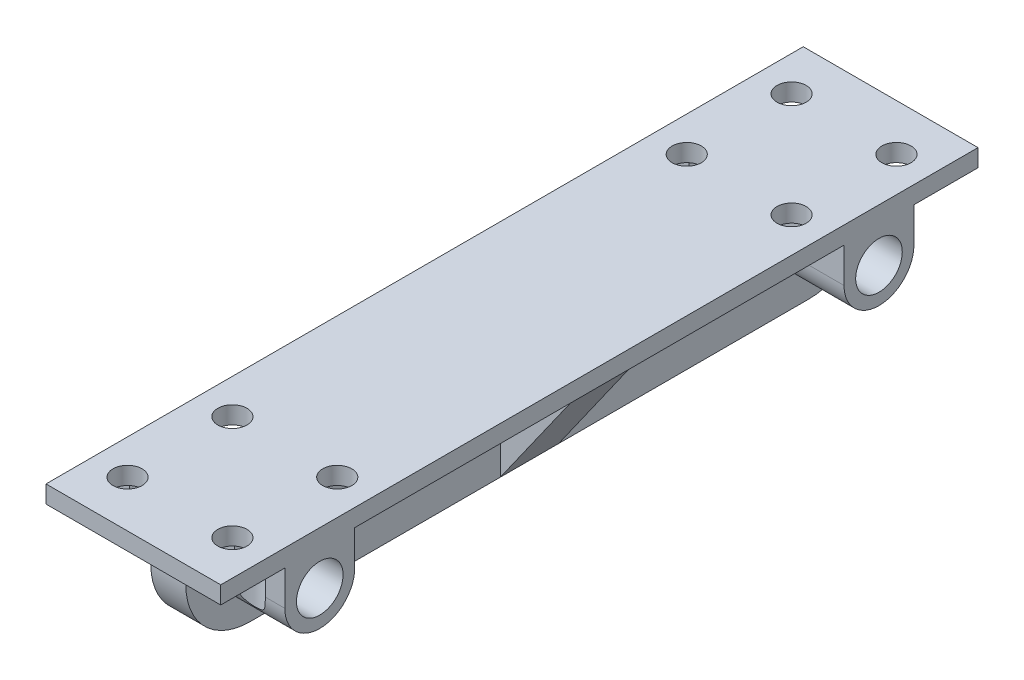
from build123d import *
from OCP.BRepFilletAPI import BRepFilletAPI_MakeChamfer

# Parameters (mm, degrees)
SKETCH1_W           = 30
SKETCH1_H           = 130
SKETCH1_R           = 2.5
BOSS_EXTRUDE1_DEPTH = 3
SKETCH2_W           = 30
SKETCH2_H           = 12
BOSS_EXTRUDE2_DEPTH = 12
CUT_EXTRUDE1_REACH  = 88.274
SKETCH3_R           = 4
FILLET1_R           = 6
SKETCH4_R           = 4
CUT_EXTRUDE2_DEPTH  = 19
SKETCH5_W           = 6
SKETCH5_H           = 84
SKETCH5_H_2         = 11
BOSS_EXTRUDE3_DEPTH = 6
CHAMFER1_SIZE       = 6
BOSS_EXTRUDE4_DEPTH = 6
SKETCH7_W           = 12
SKETCH7_H           = 10
BOSS_EXTRUDE5_DEPTH = 17
CHAMFER2_SIZE       = 17
CHAMFER2_SIZE2      = 12


with BuildPart() as part:
    # Sketch1 → Boss-Extrude1 (new body)
    with BuildSketch(Plane(origin=(0, 0, 0), x_dir=(1, 0, 0), z_dir=(0, 1, 0))):
        with Locations((-7.37923135, 14.994995261)):
            Rectangle(SKETCH1_W, SKETCH1_H)
        with Locations(Location((-16.37923135, -24.005004739, 0), (0, 0, 270))):
            Circle(SKETCH1_R, mode=Mode.SUBTRACT)
        with Locations(Location((1.62076865, -24.005004739, 0), (0, 0, 270))):
            Circle(SKETCH1_R, mode=Mode.SUBTRACT)
        with Locations(Location((1.62076865, -42.005004739, 0), (0, 0, 270))):
            Circle(SKETCH1_R, mode=Mode.SUBTRACT)
        with Locations(Location((-16.37923135, -42.005004739, 0), (0, 0, 270))):
            Circle(SKETCH1_R, mode=Mode.SUBTRACT)
        with Locations(Location((-16.37923135, 71.994995261, 0), (0, 0, 270))):
            Circle(SKETCH1_R, mode=Mode.SUBTRACT)
        with Locations(Location((-16.37923135, 53.994995261, 0), (0, 0, 270))):
            Circle(SKETCH1_R, mode=Mode.SUBTRACT)
        with Locations(Location((1.62076865, 71.994995261, 0), (0, 0, 270))):
            Circle(SKETCH1_R, mode=Mode.SUBTRACT)
        with Locations(Location((1.62076865, 53.994995261, 0), (0, 0, 270))):
            Circle(SKETCH1_R, mode=Mode.SUBTRACT)
    extrude(amount=BOSS_EXTRUDE1_DEPTH)

    # Sketch2 → Boss-Extrude2 (add)
    with BuildSketch(Plane.XZ):
        with Locations((-7.37923135, -62.994995261)):
            Rectangle(SKETCH2_W, SKETCH2_H)
        with Locations((-7.37923135, 33.005004739)):
            Rectangle(SKETCH2_W, SKETCH2_H)
    extrude(amount=BOSS_EXTRUDE2_DEPTH)

    # Sketch3 → Cut-Extrude1 (cut, up to next)
    with BuildSketch(Plane(origin=(7.62076865, 0, 0), x_dir=(0, 0, -1), z_dir=(1, 0, 0)), mode=Mode.PRIVATE) as cut_extrude1_sk1:
        with Locations((-33.005004739, -6)):
            Circle(SKETCH3_R)
    cut_extrude1_tool1 = extrude(cut_extrude1_sk1.sketch, amount=-CUT_EXTRUDE1_REACH, mode=Mode.PRIVATE) & part.part
    # Sketch3 → Cut-Extrude1 (cut, up to next)
    with BuildSketch(Plane(origin=(7.62076865, 0, 0), x_dir=(0, 0, -1), z_dir=(1, 0, 0)), mode=Mode.PRIVATE) as cut_extrude1_sk2:
        with Locations((62.994995261, -6)):
            Circle(SKETCH3_R)
    cut_extrude1_tool2 = extrude(cut_extrude1_sk2.sketch, amount=-CUT_EXTRUDE1_REACH, mode=Mode.PRIVATE) & part.part
    add(cut_extrude1_tool1.solids().sort_by_distance((7.620769, -6, 33.005005))[0], mode=Mode.SUBTRACT)
    add(cut_extrude1_tool2.solids().sort_by_distance((7.620769, -6, -62.994995))[0], mode=Mode.SUBTRACT)

    # Fillet1
    fillet1_edges = [part.edges().sort_by_distance(p)[0] for p in [
        (-7.37923135, -12, -68.994995261),
        (-7.37923135, -12, -56.994995261),
        (-7.37923135, -12, 27.005004739),
        (-7.37923135, -12, 39.005004739),
    ]]
    fillet(fillet1_edges, radius=FILLET1_R - 0.0001)  # a hair under: the kernel refuses the full size

    # Sketch4 → Cut-Extrude2 (cut)
    with BuildSketch(Plane.XZ):
        with Locations((-16.37923135, -53.994995261)):
            Circle(SKETCH4_R)
        with Locations((-16.37923135, -71.994995261)):
            Circle(SKETCH4_R)
        with Locations((1.62076865, -71.994995261)):
            Circle(SKETCH4_R)
        with Locations((1.62076865, -3.994995261)):
            Circle(SKETCH4_R)
        with Locations((1.62076865, 24.005004739)):
            Circle(SKETCH4_R)
        with Locations((-16.37923135, 24.005004739)):
            Circle(SKETCH4_R)
        with Locations((-16.37923135, 42.005004739)):
            Circle(SKETCH4_R)
        with Locations((1.62076865, 42.005004739)):
            Circle(SKETCH4_R)
    extrude(amount=CUT_EXTRUDE2_DEPTH, mode=Mode.SUBTRACT)

    # Sketch5 → Boss-Extrude3 (add)
    with BuildSketch(Plane.XZ):
        with Locations((-7.37923135, -14.994995261)):
            Rectangle(SKETCH5_W, SKETCH5_H)
        with Locations((-7.37923135, -74.494995261)):
            Rectangle(SKETCH5_W, SKETCH5_H_2)
        with Locations((-7.37923135, 44.505004739)):
            Rectangle(SKETCH5_W, SKETCH5_H_2)
    extrude(amount=BOSS_EXTRUDE3_DEPTH)

    # Chamfer1
    chamfer1_edges = [part.edges().sort_by_distance(p)[0] for p in [
        (-7.37923135, -6, -79.994995261),
        (-7.37923135, -6, 50.005004739),
    ]]
    chamfer(chamfer1_edges, length=CHAMFER1_SIZE)

    # Sketch6 → Boss-Extrude4 (add)
    with BuildSketch(Plane.ZY.offset(10.37923135)):
        with BuildLine():
            Line((-62.994995261, -17), (33.005004739, -17))
            ThreePointArc((33.005004739, -17), (40.783179332, -13.778174593), (44.005004739, -6))
            Line((44.005004739, -6), (39.005004739, -6))
            ThreePointArc((39.005004739, -6), (33.005004739, -12), (27.005004739, -6))
            Line((27.005004739, -6), (-56.994995261, -6))
            ThreePointArc((-56.994995261, -6), (-62.994995261, -12), (-68.994995261, -6))
            Line((-68.994995261, -6), (-73.994995261, -6))
            ThreePointArc((-73.994995261, -6), (-70.773169854, -13.778174593), (-62.994995261, -17))
        make_face()
    extrude(amount=-BOSS_EXTRUDE4_DEPTH)

    # Sketch7 → Boss-Extrude5 (add)
    with BuildSketch(Plane.XZ):
        with Locations((-16.37923135, -14.994995261)):
            Rectangle(SKETCH7_W, SKETCH7_H)
        with Locations((1.62076865, -14.994995261)):
            Rectangle(SKETCH7_W, SKETCH7_H)
    extrude(amount=BOSS_EXTRUDE5_DEPTH)

    # Chamfer2: one chamfer whose edges measure the first distance from different faces: ONE call of the kernel's chamfer builder (chamfer() names one face for all edges)
    chamfer2_edges_1 = [part.edges().sort_by_distance(p)[0] for p in [
        (-22.37923135, -17, -14.994995261),
    ]]
    chamfer2_side_1 = [part.faces().sort_by_distance(p)[0] for p in [
        (-22.37923135, -2.310192331, -14.994995261),
    ]]
    chamfer2_edges_2 = [part.edges().sort_by_distance(p)[0] for p in [
        (7.62076865, -17, -14.994995261),
    ]]
    chamfer2_side_2 = [part.faces().sort_by_distance(p)[0] for p in [
        (7.62076865, -2.310192331, -14.994995261),
    ]]
    chamfer2 = BRepFilletAPI_MakeChamfer(part.part.solid().wrapped)
    for e in chamfer2_edges_1:
        chamfer2.Add(CHAMFER2_SIZE, CHAMFER2_SIZE2, e.wrapped, chamfer2_side_1[0].wrapped)  # the first distance lies on this face
    for e in chamfer2_edges_2:
        chamfer2.Add(CHAMFER2_SIZE, CHAMFER2_SIZE2, e.wrapped, chamfer2_side_2[0].wrapped)  # the first distance lies on this face
    add(Compound.cast(chamfer2.Shape()), mode=Mode.REPLACE)


solid = part.part
